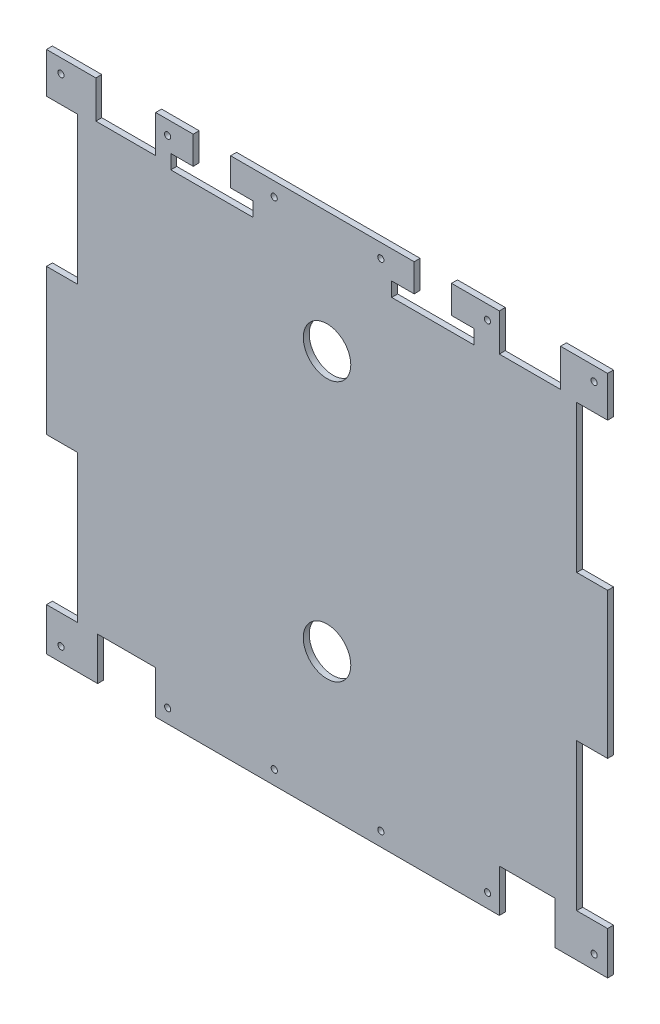
from build123d import *

# Parameters (mm, degrees)
SKETCH5_R           = 1.65
SKETCH5_R_2         = 12.7
BOSS_EXTRUDE1_DEPTH = 3.175


with BuildPart() as part:
    # Sketch5 → Boss-Extrude1 (new body)
    with BuildSketch(Plane.XY):
        Polygon((47.124604737, -7.452255775), (30.614604737, -7.452255775), (30.614604737, 71.287744225), (47.124604737, 71.287744225), (47.124604737, 149.14592508), (30.614604737, 149.14592508), (30.614604737, 227.88592508), (47.124604737, 227.88592508), (47.124604737, 249.558741302), (21.963711068, 249.558741302), (21.963711068, 229.558741302), (-10.75596688, 229.558741302), (-10.75596688, 249.558741302), (-36.302449898, 249.558741302), (-36.302449898, 234.650741302), (-24.302449898, 234.650741302), (-24.302449898, 227.030741302), (-36.302449898, 227.030741302), (-56.302449898, 227.030741302), (-68.302449898, 227.030741302), (-68.302449898, 234.650741302), (-56.302449898, 234.650741302), (-56.302449898, 249.558741302), (-154.402428268, 249.558741302), (-154.402428268, 234.650741302), (-142.402428268, 234.650741302), (-142.402428268, 227.030741302), (-154.402428268, 227.030741302), (-174.402428268, 227.030741302), (-186.402428268, 227.030741302), (-186.402428268, 234.650741302), (-174.402428268, 234.650741302), (-174.402428268, 249.558741302), (-194.45596688, 249.558741302), (-194.45596688, 229.558741302), (-226.473954569, 229.558741302), (-226.473954569, 249.558741302), (-252.849395263, 249.558741302), (-252.849395263, 227.88592508), (-236.339395263, 227.88592508), (-236.339395263, 149.14592508), (-252.849395263, 149.14592508), (-252.849395263, 71.287744225), (-236.339395263, 71.287744225), (-236.339395263, -7.452255775), (-252.849395263, -7.452255775), (-252.849395263, -30.349258698), (-225.47032966, -30.349258698), (-225.47032966, -7.452244575), (-194.45596688, -7.452244575), (-194.45596688, -30.349258698), (-10.75596688, -30.349258698), (-10.75596688, -7.452244575), (18.918860979, -7.452244575), (18.918860979, -30.349258698), (47.124604737, -30.349258698), align=None)
        with Locations((39.94351791, -22.890678842)):
            Circle(SKETCH5_R, mode=Mode.SUBTRACT)
        with Locations((-17.05648209, -22.890678842)):
            Circle(SKETCH5_R, mode=Mode.SUBTRACT)
        with Locations((-74.05648209, -22.890678842)):
            Circle(SKETCH5_R, mode=Mode.SUBTRACT)
        with Locations((-131.05648209, -22.890678842)):
            Circle(SKETCH5_R, mode=Mode.SUBTRACT)
        with Locations((-188.05648209, -22.890678842)):
            Circle(SKETCH5_R, mode=Mode.SUBTRACT)
        with Locations((-245.05648209, -22.890678842)):
            Circle(SKETCH5_R, mode=Mode.SUBTRACT)
        with Locations((39.89403312, 242.101631614)):
            Circle(SKETCH5_R, mode=Mode.SUBTRACT)
        with Locations((-17.10596688, 242.101631614)):
            Circle(SKETCH5_R, mode=Mode.SUBTRACT)
        with Locations((-74.10596688, 242.101631614)):
            Circle(SKETCH5_R, mode=Mode.SUBTRACT)
        with Locations((-131.10596688, 242.101631614)):
            Circle(SKETCH5_R, mode=Mode.SUBTRACT)
        with Locations((-188.10596688, 242.101631614)):
            Circle(SKETCH5_R, mode=Mode.SUBTRACT)
        with Locations((-245.10596688, 242.101631614)):
            Circle(SKETCH5_R, mode=Mode.SUBTRACT)
        with Locations((-102.862395263, 184.854342805)):
            Circle(SKETCH5_R_2, mode=Mode.SUBTRACT)
        with Locations((-102.862395263, 45.850741302)):
            Circle(SKETCH5_R_2, mode=Mode.SUBTRACT)
    extrude(amount=BOSS_EXTRUDE1_DEPTH)


solid = part.part
